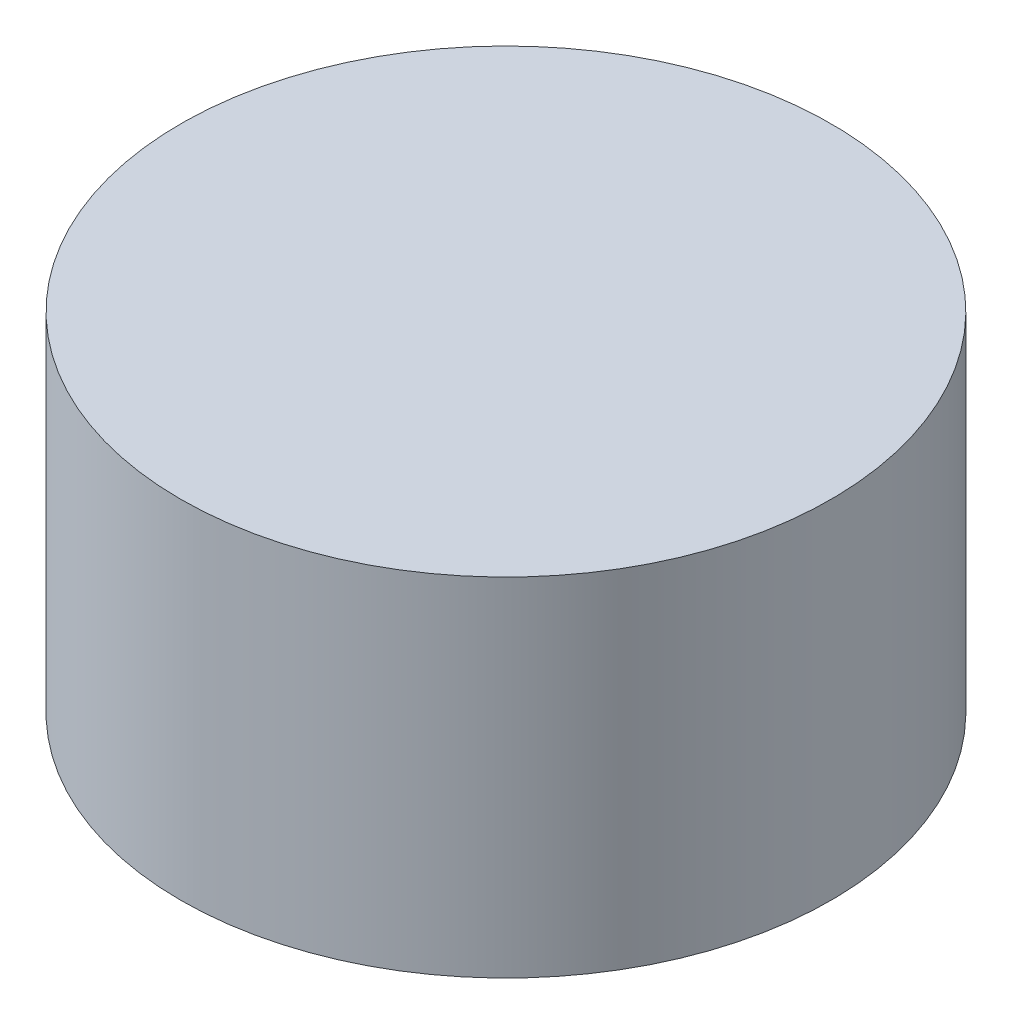
from build123d import *

# Parameters (mm, degrees)
SKETCH1_R           = 11.0363
BOSS_EXTRUDE1_DEPTH = 5.8928


with BuildPart() as part:
    # Sketch1 → Boss-Extrude1 (new, symmetric)
    with BuildSketch(Plane(origin=(0, 0, 0), x_dir=(1, 0, 0), z_dir=(0, 1, 0))):
        Circle(SKETCH1_R)
    extrude(amount=BOSS_EXTRUDE1_DEPTH, both=True)


solid = part.part
